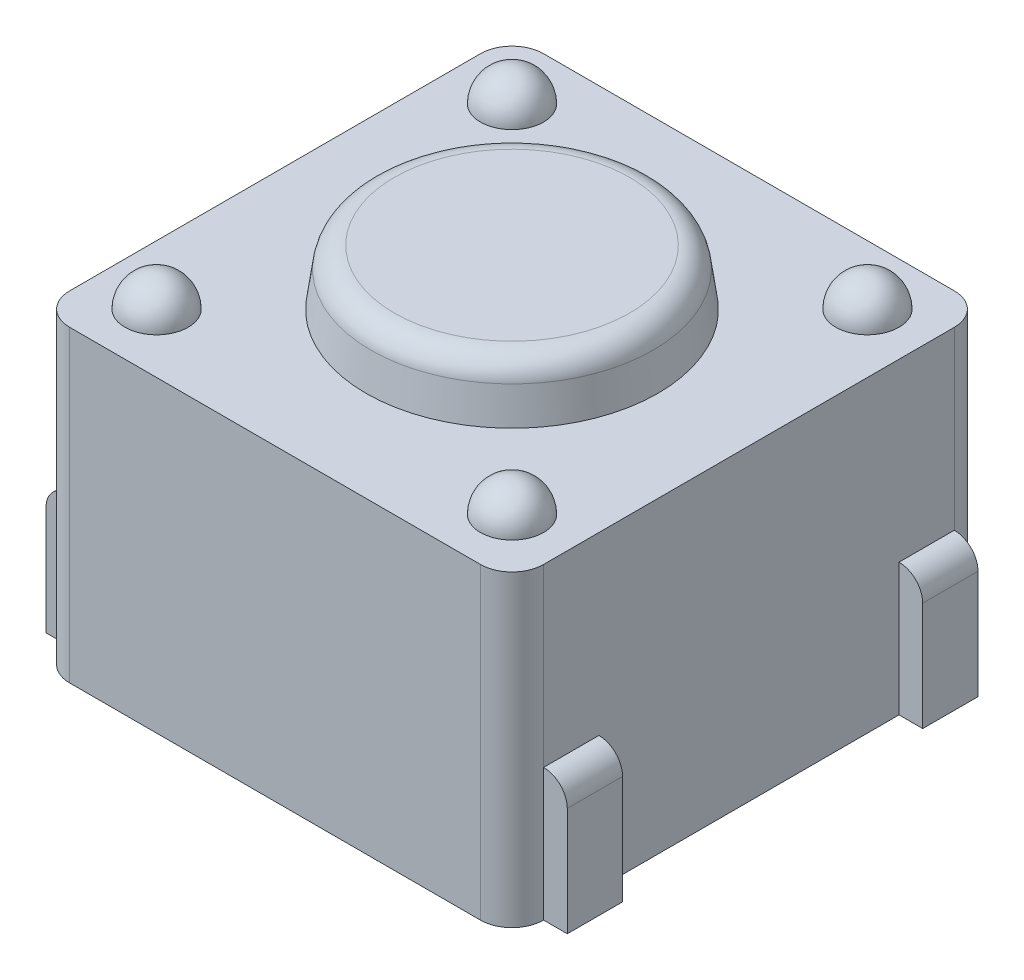
from build123d import *

# Parameters (mm, degrees)
SKETCH1_W               = 6
SKETCH1_H               = 6
BOSS_EXTRUDE1_DEPTH     = 3.9
SKETCH2_W               = 0.7
SKETCH2_H               = 1.674896981
BOSS_EXTRUDE2_DEPTH     = 0.3
SKETCH3_R               = 0.4
BOSS_EXTRUDE3_DEPTH     = 0.4
MIRROR2_COPY_1_SKETCH_W = 0.7
MIRROR2_COPY_1_SKETCH_H = 1.674896981
MIRROR2_COPY_1_DEPTH    = 0.3
MIRROR2_COPY_2_SKETCH_R = 0.4
MIRROR2_COPY_2_DEPTH    = 0.4
FILLET1_R               = 0.4
FILLET2_R               = 0.4
SKETCH4_R               = 1.75
BOSS_EXTRUDE4_DEPTH     = 0.7
DRAFT1_ANGLE            = 8
FILLET3_R               = 0.3
FILLET4_R               = 0.3


with BuildPart() as part:
    # Sketch1 → Boss-Extrude1 (new body)
    with BuildSketch(Plane(origin=(0, 0, 0), x_dir=(1, 0, 0), z_dir=(0, 1, 0))):
        Rectangle(SKETCH1_W, SKETCH1_H)
    extrude(amount=BOSS_EXTRUDE1_DEPTH)

    # Sketch2 → Boss-Extrude2 (add)
    with BuildSketch(Plane(origin=(3, 0, 0), x_dir=(0, 0, -1), z_dir=(1, 0, 0))):
        with Locations((-2.25, 0.837448491)):
            Rectangle(SKETCH2_W, SKETCH2_H)
    boss_extrude2 = extrude(amount=BOSS_EXTRUDE2_DEPTH)

    # Sketch3 → Boss-Extrude3 (add)
    with BuildSketch(Plane(origin=(0, 3.9, 0), x_dir=(1, 0, 0), z_dir=(0, 1, 0))):
        with Locations(Location((2.25, -2.25, 0), (0, 0, 90))):
            Circle(SKETCH3_R)
    boss_extrude3 = extrude(amount=BOSS_EXTRUDE3_DEPTH)

    # Mirror1: Boss-Extrude2, Boss-Extrude3 across plane
    add(boss_extrude2.mirror(Plane.XY))
    add(boss_extrude3.mirror(Plane.XY))

    # Mirror2: Boss-Extrude2, Boss-Extrude3 across plane
    add(boss_extrude2.mirror(Plane(origin=(0, 0, 0), x_dir=(0, 0, 1), z_dir=(1, 0, 0))))
    add(boss_extrude3.mirror(Plane(origin=(0, 0, 0), x_dir=(0, 0, 1), z_dir=(1, 0, 0))))

    # Mirror2 copy 1 sketch → Mirror2 copy 1 (add)
    with BuildSketch(Plane.ZY.offset(3)):
        with Locations((-2.25, 0.837448491)):
            Rectangle(MIRROR2_COPY_1_SKETCH_W, MIRROR2_COPY_1_SKETCH_H)
    extrude(amount=MIRROR2_COPY_1_DEPTH)

    # Mirror2 copy 2 sketch → Mirror2 copy 2 (add)
    with BuildSketch(Plane(origin=(0, 3.9, 0), x_dir=(-1, 0, 0), z_dir=(0, 1, 0))):
        with Locations(Location((2.25, -2.25, 0), (0, 0, 90))):
            Circle(MIRROR2_COPY_2_SKETCH_R)
    extrude(amount=MIRROR2_COPY_2_DEPTH)

    # Fillet1
    fillet1_edges = [part.edges().sort_by_distance(p)[0] for p in [
        (2.25, 4.3, 2.65),
        (2.25, 4.3, -2.65),
        (-2.25, 4.3, -2.65),
        (-2.25, 4.3, 2.65),
    ]]
    fillet(fillet1_edges, radius=FILLET1_R - 0.0001)  # a hair under: the kernel refuses the full size

    # Fillet2
    fillet2_edges = [part.edges().sort_by_distance(p)[0] for p in [
        (3, 1.95, -3),
        (-3, 1.95, -3),
        (-3, 1.95, 3),
        (3, 1.95, 3),
    ]]
    fillet(fillet2_edges, radius=FILLET2_R)

    # Sketch4 → Boss-Extrude4 (add)
    with BuildSketch(Plane(origin=(0, 3.9, 0), x_dir=(1, 0, 0), z_dir=(0, 1, 0))):
        with Locations(Location((0, 0, 0), (0, 0, 90))):
            Circle(SKETCH4_R)
    extrude(amount=BOSS_EXTRUDE4_DEPTH)

    # Draft1
    draft1_faces = [part.faces().sort_by_distance(p)[0] for p in [
        (0, 4.25, 1.75),
    ]]
    draft(draft1_faces, Plane.ZX.offset(4.6), DRAFT1_ANGLE)

    # Fillet3
    fillet3_edges = [part.edges().sort_by_distance(p)[0] for p in [
        (0, 4.6, 1.75),
    ]]
    fillet(fillet3_edges, radius=FILLET3_R)

    # Fillet4
    fillet4_edges = [part.edges().sort_by_distance(p)[0] for p in [
        (-3.3, 1.674896981, -2.25),
        (-3.3, 1.674896981, 2.25),
        (3.3, 1.674896981, -2.25),
        (3.3, 1.674896981, 2.25),
    ]]
    fillet(fillet4_edges, radius=FILLET4_R - 0.0001)  # a hair under: the kernel refuses the full size


solid = part.part
